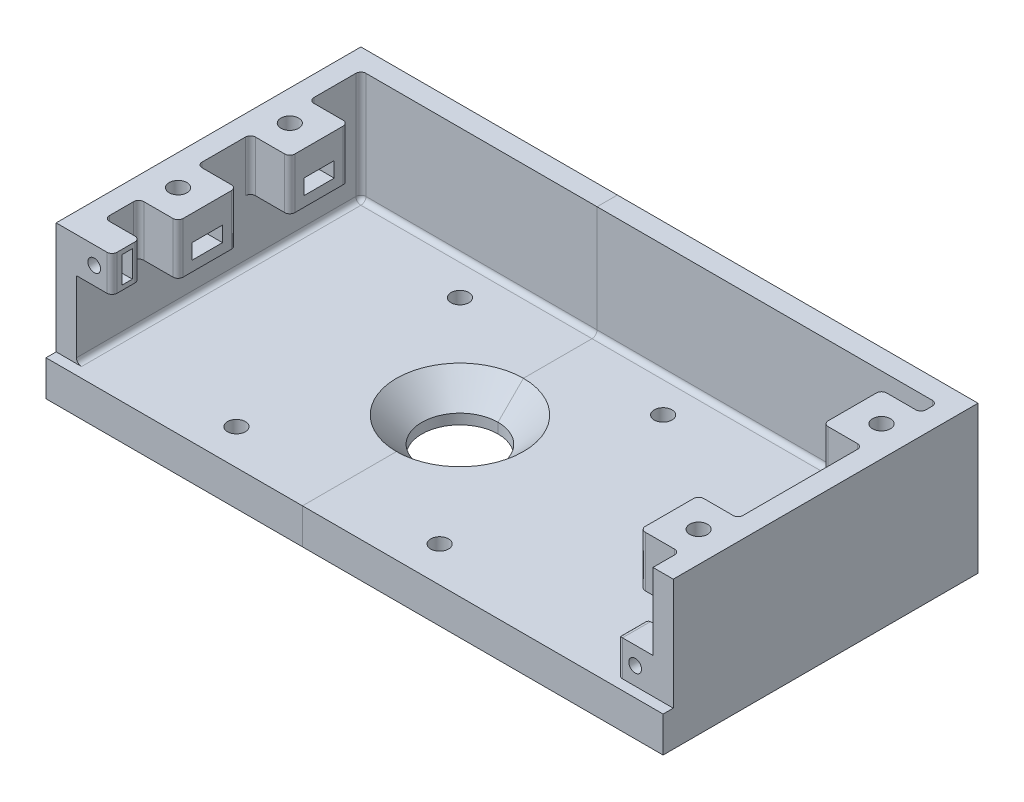
from build123d import *

# Parameters (mm, degrees)
SKETCH1_W              = 121.5
SKETCH1_H              = 62
BOSS_EXTRUDE1_DEPTH    = 7
BOSS_EXTRUDE2_DEPTH    = 22
SKETCH5_W              = 11.5
SKETCH5_H              = 11.5
BOSS_EXTRUDE3_DEPTH    = 10
CUT_EXTRUDE1_START     = 2
CUT_EXTRUDE1_DEPTH     = 3
CUT_EXTRUDE2_REACH     = 84.722
SKETCH7_R              = 1.75
SKETCH8_W              = 7
SKETCH8_H              = 7
SKETCH8_R              = 1.25
BOSS_EXTRUDE5_DEPTH    = 5.5
CUT_EXTRUDE3_START     = -2
SKETCH9_R              = 1.25
CUT_EXTRUDE3_DEPTH     = 2
SKETCH11_R             = 1.75
CUT_EXTRUDE4_DEPTH     = 81.535706367
FILLET1_R              = 1
SPLIT1_SURFACE_1_BACK  = 140.453
SPLIT1_SURFACE_1_DEPTH = 280.906
SPLIT1_SURFACE_2_BACK  = 140.453
SPLIT1_SURFACE_2_DEPTH = 280.906


with BuildPart() as part:
    # Sketch1 → Boss-Extrude1 (new body)
    with BuildSketch(Plane(origin=(0, 0, 0), x_dir=(1, 0, 0), z_dir=(0, 1, 0))):
        with Locations((10.25, 0)):
            Rectangle(SKETCH1_W, SKETCH1_H)
    extrude(amount=BOSS_EXTRUDE1_DEPTH)

    # Sketch3 → CSK for M10 Flat Head Machine Screw1 (revolve, cut)
    with BuildSketch(Plane(origin=(0, 7, 0), x_dir=(0, 0, 1), z_dir=(1, 0, 0))):
        Polygon((0, 0), (0, 7), (7.5, 7), (7.5, 5), (12.5, 0), align=None)
    revolve(axis=Axis((0, 13.35, 0), (0, -1, 0)), mode=Mode.SUBTRACT)

    # Sketch4 → Boss-Extrude2 (add)
    with BuildSketch(Plane(origin=(0, 7, 0), x_dir=(1, 0, 0), z_dir=(0, 1, 0))):
        Polygon((71, 31), (-50.5, 31), (-50.5, -29), (-46.5, -29), (-46.5, 27), (67, 27), (67, -29), (71, -29), align=None)
    extrude(amount=BOSS_EXTRUDE2_DEPTH)

    # Sketch5 → Boss-Extrude3 (add)
    with BuildSketch(Plane(origin=(0, 29, 0), x_dir=(1, 0, 0), z_dir=(0, 1, 0))):
        with Locations((-44.5, 11)):
            Rectangle(SKETCH5_W, SKETCH5_H)
        with Locations((-44.5, -11)):
            Rectangle(SKETCH5_W, SKETCH5_H)
        with Locations((65, 18)):
            Rectangle(SKETCH5_W, SKETCH5_H)
        with Locations((65, -18)):
            Rectangle(SKETCH5_W, SKETCH5_H)
    extrude(amount=-BOSS_EXTRUDE3_DEPTH)

    # Sketch6 → Cut-Extrude1 (cut)
    with BuildSketch(Plane(origin=(0, 19, 0), x_dir=(1, 0, 0), z_dir=(0, 1, 0)).offset(CUT_EXTRUDE1_START)):
        Polygon((-38.75, -8), (-46.232050808, -8), (-47.964101615, -11), (-46.232050808, -14), (-38.75, -14), align=None)
        Polygon((-47.964101615, 11), (-46.232050808, 8), (-38.75, 8), (-38.75, 14), (-46.232050808, 14), align=None)
        Polygon((66.732050808, 15), (68.464101615, 18), (66.732050808, 21), (59.25, 21), (59.25, 15), align=None)
        Polygon((66.732050808, -21), (68.464101615, -18), (66.732050808, -15), (59.25, -15), (59.25, -21), align=None)
    extrude(amount=CUT_EXTRUDE1_DEPTH, mode=Mode.SUBTRACT)

    # Cut-Extrude2: up to this face of the body (flat: up to its plane)
    cut_extrude2_end = Plane(part.part.faces().sort_by_distance((63.125, 19, 18))[0])
    # Sketch7 → Cut-Extrude2 (cut, up to the picked face)
    with BuildSketch(Plane(origin=(0, 29, 0), x_dir=(1, 0, 0), z_dir=(0, 1, 0)), mode=Mode.PRIVATE) as cut_extrude2_sk1:
        with Locations(Location((-44.5, 11, 0), (0, 0, 270))):
            Circle(SKETCH7_R)
    cut_extrude2_tool1 = split(extrude(cut_extrude2_sk1.sketch, amount=-CUT_EXTRUDE2_REACH, mode=Mode.PRIVATE), bisect_by=cut_extrude2_end, keep=Keep.BOTH, mode=Mode.PRIVATE)
    # Sketch7 → Cut-Extrude2 (cut, up to the picked face)
    with BuildSketch(Plane(origin=(0, 29, 0), x_dir=(1, 0, 0), z_dir=(0, 1, 0)), mode=Mode.PRIVATE) as cut_extrude2_sk2:
        with Locations(Location((-44.5, -11, 0), (0, 0, 270))):
            Circle(SKETCH7_R)
    cut_extrude2_tool2 = split(extrude(cut_extrude2_sk2.sketch, amount=-CUT_EXTRUDE2_REACH, mode=Mode.PRIVATE), bisect_by=cut_extrude2_end, keep=Keep.BOTH, mode=Mode.PRIVATE)
    # Sketch7 → Cut-Extrude2 (cut, up to the picked face)
    with BuildSketch(Plane(origin=(0, 29, 0), x_dir=(1, 0, 0), z_dir=(0, 1, 0)), mode=Mode.PRIVATE) as cut_extrude2_sk3:
        with Locations(Location((65, 18, 0), (0, 0, 270))):
            Circle(SKETCH7_R)
    cut_extrude2_tool3 = split(extrude(cut_extrude2_sk3.sketch, amount=-CUT_EXTRUDE2_REACH, mode=Mode.PRIVATE), bisect_by=cut_extrude2_end, keep=Keep.BOTH, mode=Mode.PRIVATE)
    # Sketch7 → Cut-Extrude2 (cut, up to the picked face)
    with BuildSketch(Plane(origin=(0, 29, 0), x_dir=(1, 0, 0), z_dir=(0, 1, 0)), mode=Mode.PRIVATE) as cut_extrude2_sk4:
        with Locations(Location((65, -18, 0), (0, 0, 270))):
            Circle(SKETCH7_R)
    cut_extrude2_tool4 = split(extrude(cut_extrude2_sk4.sketch, amount=-CUT_EXTRUDE2_REACH, mode=Mode.PRIVATE), bisect_by=cut_extrude2_end, keep=Keep.BOTH, mode=Mode.PRIVATE)
    add(cut_extrude2_tool1.solids().sort_by(Axis((-44.5, 29, -11), (0, -1, 0)))[0], mode=Mode.SUBTRACT)
    add(cut_extrude2_tool2.solids().sort_by(Axis((-44.5, 29, 11), (0, -1, 0)))[0], mode=Mode.SUBTRACT)
    add(cut_extrude2_tool3.solids().sort_by(Axis((65, 29, -18), (0, -1, 0)))[0], mode=Mode.SUBTRACT)
    add(cut_extrude2_tool4.solids().sort_by(Axis((65, 29, 18), (0, -1, 0)))[0], mode=Mode.SUBTRACT)

    # Sketch8 → Boss-Extrude5 (add)
    # profile 1 of 2: a face of its own
    with BuildSketch(Plane.XY.offset(29)):
        with Locations((-43, 25.5)):
            Rectangle(SKETCH8_W, SKETCH8_H)
        with Locations((-43, 25.5)):
            Circle(SKETCH8_R, mode=Mode.SUBTRACT)
    # profile 2 of 2: a face of its own
    with BuildSketch(Plane.XY.offset(29)):
        with Locations((63.5, 10.5)):
            Rectangle(SKETCH8_W, SKETCH8_H)
        with Locations((63.5, 10.5)):
            Circle(SKETCH8_R, mode=Mode.SUBTRACT)
    extrude(amount=-BOSS_EXTRUDE5_DEPTH)

    # Sketch9 → Cut-Extrude3 (cut)
    # profile 1 of 4: a face of its own
    with BuildSketch(Plane.XY.offset(29).offset(CUT_EXTRUDE3_START)):
        Polygon((-39.5, 28.098076211), (-43, 28.098076211), (-40.75, 26.799038106), (-40.75, 24.200961894), (-43, 22.901923789), (-39.5, 22.901923789), align=None)
    # profile 2 of 4: a face of its own
    with BuildSketch(Plane.XY.offset(29).offset(CUT_EXTRUDE3_START)):
        Polygon((-45.25, 24.200961894), (-43, 22.901923789), (-40.75, 24.200961894), (-40.75, 26.799038106), (-43, 28.098076211), (-45.25, 26.799038106), align=None)
        with Locations((-43, 25.5)):
            Circle(SKETCH9_R, mode=Mode.SUBTRACT)
    # profile 3 of 4: a face of its own
    with BuildSketch(Plane.XY.offset(29).offset(CUT_EXTRUDE3_START)):
        Polygon((60, 13.098076211), (60, 7.901923789), (63.5, 7.901923789), (61.25, 9.200961894), (61.25, 11.799038106), (63.5, 13.098076211), align=None)
    # profile 4 of 4: a face of its own
    with BuildSketch(Plane.XY.offset(29).offset(CUT_EXTRUDE3_START)):
        Polygon((61.25, 9.200961894), (63.5, 7.901923789), (65.75, 9.200961894), (65.75, 11.799038106), (63.5, 13.098076211), (61.25, 11.799038106), align=None)
    extrude(amount=-CUT_EXTRUDE3_DEPTH, mode=Mode.SUBTRACT)

    # Sketch11 → Cut-Extrude4 (cut, through all)
    with BuildSketch(Plane(origin=(0, 7, 0), x_dir=(1, 0, 0), z_dir=(0, 1, 0))):
        with Locations(Location((-20, 20, 0), (0, 0, 270))):
            Circle(SKETCH11_R)
        with Locations(Location((20, 20, 0), (0, 0, 270))):
            Circle(SKETCH11_R)
        with Locations(Location((-20, -24, 0), (0, 0, 270))):
            Circle(SKETCH11_R)
        with Locations(Location((20, -24, 0), (0, 0, 270))):
            Circle(SKETCH11_R)
    extrude(amount=-CUT_EXTRUDE4_DEPTH, mode=Mode.SUBTRACT)

    # Fillet1
    # the kernel refuses this fillet: 1 mm, written as the material it adds along each edge
    with BuildSketch(Plane(origin=(66, 8, -26), x_dir=(1, 0, 0), z_dir=(0, 0, -1))) as fillet1_piece_1_section:
        Polygon((0, 0), (FILLET1_R, 0), (FILLET1_R, FILLET1_R), (0, FILLET1_R), align=None)
    fillet1_piece_1 = extrude(amount=FILLET1_R, mode=Mode.PRIVATE)
    fillet1_piece_1 = fillet1_piece_1 - Plane(origin=(66, 8, -26), x_dir=(-0.7071067811865475, 0.7071067811865475, 0), z_dir=(0, 0, -1)) * Sphere(FILLET1_R, mode=Mode.PRIVATE)
    add(fillet1_piece_1)
    with BuildSketch(Plane(origin=(-45.5, 8, -26), x_dir=(-1, 0, 0), z_dir=(0, 0, -1))) as fillet1_piece_2_section:
        Polygon((0, 0), (FILLET1_R, 0), (FILLET1_R, -FILLET1_R), (0, -FILLET1_R), align=None)
    fillet1_piece_2 = extrude(amount=FILLET1_R, mode=Mode.PRIVATE)
    fillet1_piece_2 = fillet1_piece_2 - Plane(origin=(-45.5, 8, -26), x_dir=(0.7071067811865475, 0.7071067811865475, 0), z_dir=(0, 0, -1)) * Sphere(FILLET1_R, mode=Mode.PRIVATE)
    add(fillet1_piece_2)
    with BuildSketch(Plane(origin=(67, 14, 23.5), x_dir=(0, 0, -1), z_dir=(0, -1, 0))) as fillet1_piece_3:
        with BuildLine():
            CenterArc((FILLET1_R, -FILLET1_R), FILLET1_R, 90, 90)
            Line((0, -FILLET1_R), (0, 0))
            Line((0, 0), (FILLET1_R, 0))
        make_face()
    extrude(amount=9.5)
    with BuildSketch(Plane(origin=(67, 19, 23.75), x_dir=(0, 0, 1), z_dir=(0, 1, 0)), Plane(origin=(67, 29, 12.25), x_dir=(0, 0, -1), z_dir=(0, -1, 0)), Plane(origin=(67, 19, -12.25), x_dir=(0, 0, 1), z_dir=(0, 1, 0)), Plane(origin=(67, 29, -23.75), x_dir=(0, 0, -1), z_dir=(0, -1, 0)), Plane(origin=(-46.5, 19, -16.75), x_dir=(0, 0, -1), z_dir=(0, 1, 0)), Plane(origin=(-46.5, 29, -5.25), x_dir=(0, 0, 1), z_dir=(0, -1, 0)), Plane(origin=(-46.5, 19, 5.25), x_dir=(0, 0, -1), z_dir=(0, 1, 0)), Plane(origin=(-46.5, 29, 16.75), x_dir=(0, 0, 1), z_dir=(0, -1, 0))) as fillet1_piece_4:
        with BuildLine():
            CenterArc((FILLET1_R, -FILLET1_R), FILLET1_R, 90, 90)
            Line((0, -FILLET1_R), (0, 0))
            Line((0, 0), (FILLET1_R, 0))
        make_face()
    extrude(amount=10)
    with BuildSketch(Plane(origin=(67, 8, -27), x_dir=(-1, 0, 0), z_dir=(0, 1, 0)), Plane(origin=(-46.5, 8, -27), x_dir=(0, 0, 1), z_dir=(0, 1, 0))) as fillet1_piece_5:
        with BuildLine():
            CenterArc((FILLET1_R, FILLET1_R), FILLET1_R, 180, 90)
            Line((0, FILLET1_R), (0, 0))
            Line((0, 0), (FILLET1_R, 0))
        make_face()
    extrude(amount=21)
    with BuildSketch(Plane(origin=(-46.5, 22, 23.5), x_dir=(1, 0, 0), z_dir=(0, 1, 0))) as fillet1_piece_6:
        with BuildLine():
            CenterArc((FILLET1_R, FILLET1_R), FILLET1_R, 180, 90)
            Line((0, FILLET1_R), (0, 0))
            Line((0, 0), (FILLET1_R, 0))
        make_face()
    extrude(amount=7)
    with BuildSketch(Plane(origin=(67, 7, -26), x_dir=(-1, 0, 0), z_dir=(0, 0, 1))) as fillet1_piece_7:
        with BuildLine():
            CenterArc((FILLET1_R, -FILLET1_R), FILLET1_R, 90, 90)
            Line((0, -FILLET1_R), (0, 0))
            Line((0, 0), (FILLET1_R, 0))
        make_face()
    extrude(amount=52)
    with BuildSketch(Plane(origin=(-46.5, 7, 29), x_dir=(1, 0, 0), z_dir=(0, 0, -1))) as fillet1_piece_8:
        with BuildLine():
            CenterArc((FILLET1_R, -FILLET1_R), FILLET1_R, 90, 90)
            Line((0, -FILLET1_R), (0, 0))
            Line((0, 0), (FILLET1_R, 0))
        make_face()
    extrude(amount=55)
    with BuildSketch(Plane(origin=(-45.5, 7, -27), x_dir=(0, 0, 1), z_dir=(1, 0, 0))) as fillet1_piece_9:
        with BuildLine():
            CenterArc((FILLET1_R, -FILLET1_R), FILLET1_R, 90, 90)
            Line((0, -FILLET1_R), (0, 0))
            Line((0, 0), (FILLET1_R, 0))
        make_face()
    extrude(amount=111.5)
    # the kernel refuses this fillet: 1 mm, written as the material it takes off along each edge
    with BuildSketch(Plane(origin=(60, 14, 31.5), x_dir=(1, 0, 0), z_dir=(0, 0, -1))) as fillet1_2_piece_1:
        with BuildLine():
            CenterArc((FILLET1_R, FILLET1_R), FILLET1_R, 180, 90)
            Line((0, FILLET1_R), (0, 0))
            Line((0, 0), (FILLET1_R, 0))
        make_face()
    extrude(amount=10.5, mode=Mode.SUBTRACT)
    with BuildSketch(Plane(origin=(60, 7, 29), x_dir=(1, 0, 0), z_dir=(0, 1, 0)), Plane(origin=(60, 7, 23.5), x_dir=(0, 0, 1), z_dir=(0, 1, 0))) as fillet1_2_piece_2:
        with BuildLine():
            CenterArc((FILLET1_R, FILLET1_R), FILLET1_R, 180, 90)
            Line((0, FILLET1_R), (0, 0))
            Line((0, 0), (FILLET1_R, 0))
        make_face()
    extrude(amount=9.5, mode=Mode.SUBTRACT)
    with BuildSketch(Plane(origin=(59.25, 31.5, 12.25), x_dir=(0, 0, 1), z_dir=(0, -1, 0)), Plane(origin=(59.25, 31.5, 23.75), x_dir=(1, 0, 0), z_dir=(0, -1, 0)), Plane(origin=(59.25, 31.5, -23.75), x_dir=(0, 0, 1), z_dir=(0, -1, 0)), Plane(origin=(59.25, 31.5, -12.25), x_dir=(1, 0, 0), z_dir=(0, -1, 0)), Plane(origin=(-38.75, 31.5, -5.25), x_dir=(0, 0, -1), z_dir=(0, -1, 0)), Plane(origin=(-38.75, 31.5, -16.75), x_dir=(-1, 0, 0), z_dir=(0, -1, 0)), Plane(origin=(-38.75, 31.5, 16.75), x_dir=(0, 0, -1), z_dir=(0, -1, 0)), Plane(origin=(-38.75, 31.5, 5.25), x_dir=(-1, 0, 0), z_dir=(0, -1, 0))) as fillet1_2_piece_3:
        with BuildLine():
            CenterArc((FILLET1_R, -FILLET1_R), FILLET1_R, 90, 90)
            Line((0, -FILLET1_R), (0, 0))
            Line((0, 0), (FILLET1_R, 0))
        make_face()
    extrude(amount=15, mode=Mode.SUBTRACT)
    with BuildSketch(Plane(origin=(-39.5, 31.5, 23.5), x_dir=(-1, 0, 0), z_dir=(0, -1, 0)), Plane(origin=(-39.5, 31.5, 29), x_dir=(0, 0, -1), z_dir=(0, -1, 0))) as fillet1_2_piece_4:
        with BuildLine():
            CenterArc((FILLET1_R, -FILLET1_R), FILLET1_R, 90, 90)
            Line((0, -FILLET1_R), (0, 0))
            Line((0, 0), (FILLET1_R, 0))
        make_face()
    extrude(amount=12, mode=Mode.SUBTRACT)


with BuildPart() as body_2:
    # Split1: the piece behind the surface
    add(part.part)
    # Split1 surface: a surface, the sketch's curves swept straight by 280.906 mm
    with BuildLine(Plane(origin=(0, 29, 0), x_dir=(1, 0, 0), z_dir=(0, 1, 0)).offset(-SPLIT1_SURFACE_1_BACK), mode=Mode.PRIVATE) as split1_surface_1_path:
        Line((0, 31), (0, -31))
    split1_surface_1 = Shell.extrude(split1_surface_1_path.wire(), (0 * SPLIT1_SURFACE_1_DEPTH, 1 * SPLIT1_SURFACE_1_DEPTH, 0 * SPLIT1_SURFACE_1_DEPTH))
    split(bisect_by=split1_surface_1, keep=Keep.BOTTOM)


with BuildPart() as part_1:
    add(part.part)

    # Split1: split by a surface, the side it looks to stays
    # Split1 surface: a surface, the sketch's curves swept straight by 280.906 mm
    with BuildLine(Plane(origin=(0, 29, 0), x_dir=(1, 0, 0), z_dir=(0, 1, 0)).offset(-SPLIT1_SURFACE_2_BACK), mode=Mode.PRIVATE) as split1_surface_2_path:
        Line((0, 31), (0, -31))
    split1_surface_2 = Shell.extrude(split1_surface_2_path.wire(), (0 * SPLIT1_SURFACE_2_DEPTH, 1 * SPLIT1_SURFACE_2_DEPTH, 0 * SPLIT1_SURFACE_2_DEPTH))
    split(bisect_by=split1_surface_2, keep=Keep.TOP)


solid = Compound([body_2.part, part_1.part])
